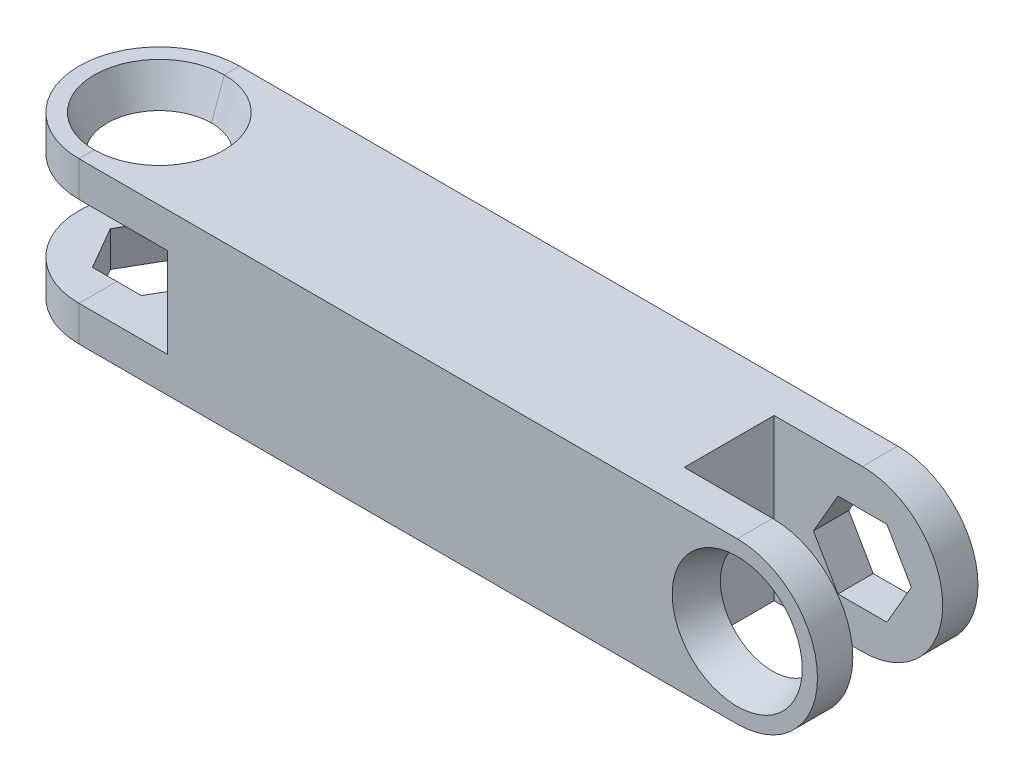
from build123d import *

# Parameters (mm, degrees)
EXTRUDE_1_DEPTH      = 10
SKETCH_3_W           = 10.5
SKETCH_3_H           = 5.6
CUT_EXTRUDE_2_DEPTH  = 30.159046624
EXTRUDE_5_DEPTH      = 5
SKETCH_2_R           = 4.05
CUT_EXTRUDE_4_DEPTH  = 2.4
CUT_EXTRUDE_4_DRAFT  = -20
SKETCH_11_W          = 10.5
SKETCH_11_H          = 5.6
CUT_EXTRUDE_11_DEPTH = 28.843311585
CUT_EXTRUDE_13_DEPTH = 2.5
CUT_EXTRUDE_14_DEPTH = 2.5


# Read off the part's stored shape, not the designer's step: 除料-伸長10
with BuildPart() as part:
    # 草圖1 → 填料-伸長1 (new body)
    with BuildSketch(Plane.XY):
        with BuildLine():
            Line((-20.5, 5), (-20.5, -5))
            Line((-20.5, -5), (20.5, -5))
            ThreePointArc((20.5, -5), (25.5, 0), (20.5, 5))
            Line((20.5, 5), (-20.5, 5))
        make_face()
    extrude(amount=EXTRUDE_1_DEPTH)

    # 草圖3 → 除料-伸長2 (cut, through all)
    with BuildSketch(Plane(origin=(0, 5, 0), x_dir=(1, 0, 0), z_dir=(0, 1, 0))):
        with Locations((20.25, -5)):
            Rectangle(SKETCH_3_W, SKETCH_3_H)
    extrude(amount=-CUT_EXTRUDE_2_DEPTH, mode=Mode.SUBTRACT)


with BuildPart() as body_2:
    # 草圖10 → 填料-伸長5 (new, symmetric)
    with BuildSketch(Plane(origin=(0, 0, 0), x_dir=(1, 0, 0), z_dir=(0, 1, 0))):
        with BuildLine():
            Line((-20.5, 0), (-20.5, -10))
            ThreePointArc((-20.5, -10), (-25.5, -5), (-20.5, 0))
        make_face()
    extrude(amount=EXTRUDE_5_DEPTH, both=True)


with BuildPart() as cut_extrude_4_tool:
    # 草圖2 → 除料-伸長4 (with draft: the straight prism first)
    with BuildSketch(Plane.XY.offset(10)):
        with Locations((20.5, 0)):
            Circle(SKETCH_2_R)
    extrude(amount=-CUT_EXTRUDE_4_DEPTH)
    # 除料-伸長4: the draft: its side faces are tilted about the plane it starts from
    cut_extrude_4_sides = [cut_extrude_4_tool.faces().sort_by_distance(p)[0] for p in [
        (16.45, 0, 8.8),
    ]]
    draft(cut_extrude_4_sides, Plane.XY.offset(10), CUT_EXTRUDE_4_DRAFT)


with BuildPart() as part_1:
    add(part.part)

    # 除料-伸長4: cut by cut_extrude_4_tool
    add(cut_extrude_4_tool.part, mode=Mode.SUBTRACT)


with BuildPart() as cut_extrude_10_tool:
    # 除料-伸長10 outline → 除料-伸長10 (revolve)
    with BuildSketch(Plane(origin=(-20.5, 0, 5), x_dir=(1, 0, 0), z_dir=(0, 0, 1))):
        Polygon((0, 5), (0, 2), (2.958089297, 2), (4.05, 5), align=None)
    revolve(axis=Axis((-20.5, 0, 5), (0, 1, 0)))


with BuildPart() as part_2:
    add(part_1.part)

    # 除料-伸長10: cut by cut_extrude_10_tool
    add(cut_extrude_10_tool.part, mode=Mode.SUBTRACT)


with BuildPart() as body_2_1:
    add(body_2.part)

    # 除料-伸長10: cut by cut_extrude_10_tool
    add(cut_extrude_10_tool.part, mode=Mode.SUBTRACT)


with BuildPart() as cut_extrude_11_tool:
    # 草圖11 → 除料-伸長11 (new, through all)
    with BuildSketch(Plane.XY):
        with Locations((-20.25, 0)):
            Rectangle(SKETCH_11_W, SKETCH_11_H)
    extrude(amount=CUT_EXTRUDE_11_DEPTH)


with BuildPart() as part_3:
    add(part_2.part)

    # 除料-伸長11: cut by cut_extrude_11_tool
    add(cut_extrude_11_tool.part, mode=Mode.SUBTRACT)

    # 草圖15 → 除料-伸長13 (cut)
    with BuildSketch(Plane(origin=(0, 0, 0), x_dir=(-1, 0, 0), z_dir=(0, 0, -1))):
        Polygon((-18.975, 2.641377482), (-22.025, 2.641377482), (-23.55, 0), (-22.025, -2.641377482), (-18.975, -2.641377482), (-17.45, 0), align=None)
    extrude(amount=-CUT_EXTRUDE_13_DEPTH, mode=Mode.SUBTRACT)


with BuildPart() as body_2_2:
    add(body_2_1.part)

    # 除料-伸長11: cut by cut_extrude_11_tool
    add(cut_extrude_11_tool.part, mode=Mode.SUBTRACT)


with BuildPart() as cut_extrude_14_tool:
    # 草圖16 → 除料-伸長14 (new body)
    with BuildSketch(Plane.XZ.offset(5)):
        Polygon((-17.45, 5), (-18.975, 7.641377482), (-22.025, 7.641377482), (-23.55, 5), (-22.025, 2.358622518), (-18.975, 2.358622518), align=None)
    extrude(amount=-CUT_EXTRUDE_14_DEPTH)


with BuildPart() as part_4:
    add(part_3.part)

    # 除料-伸長14: cut by cut_extrude_14_tool
    add(cut_extrude_14_tool.part, mode=Mode.SUBTRACT)


with BuildPart() as body_2_3:
    add(body_2_2.part)

    # 除料-伸長14: cut by cut_extrude_14_tool
    add(cut_extrude_14_tool.part, mode=Mode.SUBTRACT)


solid = Compound([part_4.part, body_2_3.part])
